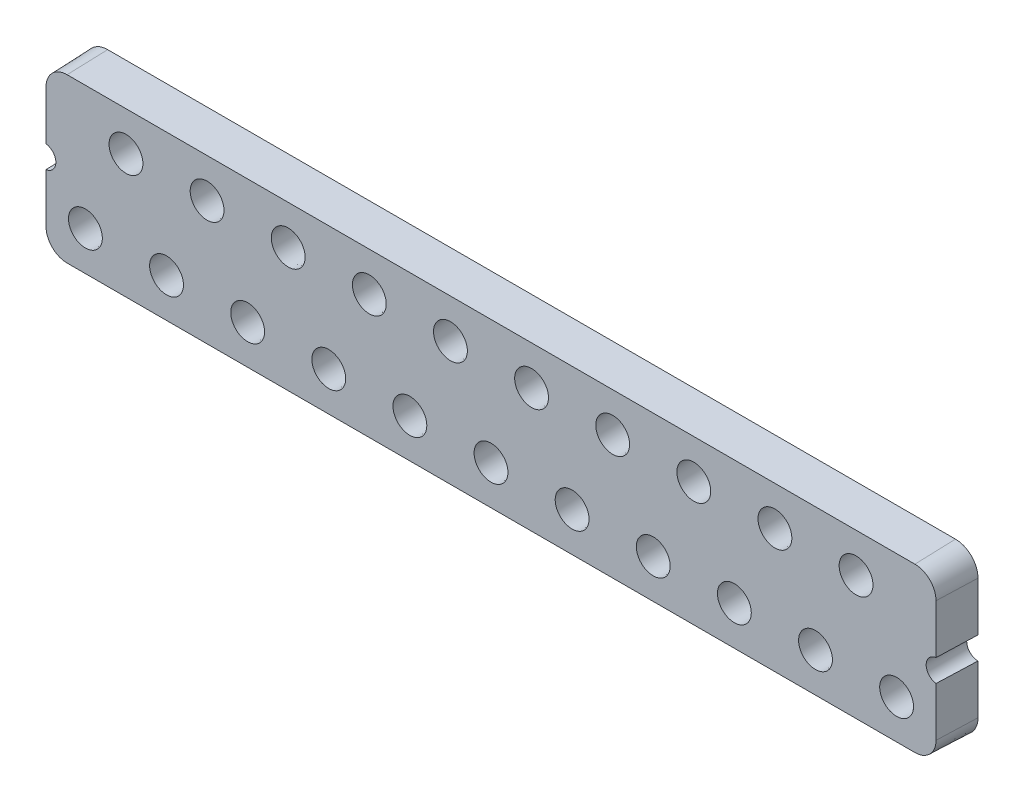
from build123d import *

# Parameters (mm, degrees)
BOSS_EXTRUDE1_DEPTH           = 1.8
BOSS_EXTRUDE1_TAPER           = 2
SKETCH10_R                    = 1.223
CUT_EXTRUDE2_DEPTH            = 0.25
CUT_EXTRUDE2_DRAFT            = 2
CUT_EXTRUDE2_PROFILE_2_DEPTH  = 0.25
CUT_EXTRUDE2_PROFILE_2_DRAFT  = 2
CUT_EXTRUDE2_PROFILE_3_DEPTH  = 0.25
CUT_EXTRUDE2_PROFILE_3_DRAFT  = 2
CUT_EXTRUDE2_PROFILE_4_DEPTH  = 0.25
CUT_EXTRUDE2_PROFILE_4_DRAFT  = 2
CUT_EXTRUDE2_PROFILE_5_DEPTH  = 0.25
CUT_EXTRUDE2_PROFILE_5_DRAFT  = 2
CUT_EXTRUDE2_PROFILE_6_DEPTH  = 0.25
CUT_EXTRUDE2_PROFILE_6_DRAFT  = 2
CUT_EXTRUDE2_PROFILE_7_DEPTH  = 0.25
CUT_EXTRUDE2_PROFILE_7_DRAFT  = 2
CUT_EXTRUDE2_PROFILE_8_DEPTH  = 0.25
CUT_EXTRUDE2_PROFILE_8_DRAFT  = 2
CUT_EXTRUDE2_PROFILE_9_DEPTH  = 0.25
CUT_EXTRUDE2_PROFILE_9_DRAFT  = 2
CUT_EXTRUDE2_PROFILE_10_DEPTH = 0.25
CUT_EXTRUDE2_PROFILE_10_DRAFT = 2
CUT_EXTRUDE2_PROFILE_11_DEPTH = 0.25
CUT_EXTRUDE2_PROFILE_11_DRAFT = 2
CUT_EXTRUDE2_PROFILE_12_DEPTH = 0.25
CUT_EXTRUDE2_PROFILE_12_DRAFT = 2
CUT_EXTRUDE2_PROFILE_13_DEPTH = 0.25
CUT_EXTRUDE2_PROFILE_13_DRAFT = 2
CUT_EXTRUDE2_PROFILE_14_DEPTH = 0.25
CUT_EXTRUDE2_PROFILE_14_DRAFT = 2
CUT_EXTRUDE2_PROFILE_15_DEPTH = 0.25
CUT_EXTRUDE2_PROFILE_15_DRAFT = 2
CUT_EXTRUDE2_PROFILE_16_DEPTH = 0.25
CUT_EXTRUDE2_PROFILE_16_DRAFT = 2
CUT_EXTRUDE2_PROFILE_17_DEPTH = 0.25
CUT_EXTRUDE2_PROFILE_17_DRAFT = 2
CUT_EXTRUDE2_PROFILE_18_DEPTH = 0.25
CUT_EXTRUDE2_PROFILE_18_DRAFT = 2
CUT_EXTRUDE2_PROFILE_19_DEPTH = 0.25
CUT_EXTRUDE2_PROFILE_19_DRAFT = 2
CUT_EXTRUDE2_PROFILE_20_DEPTH = 0.25
CUT_EXTRUDE2_PROFILE_20_DRAFT = 2
CUT_EXTRUDE2_PROFILE_21_DEPTH = 0.25
CUT_EXTRUDE2_PROFILE_21_DRAFT = 2
SKETCH9_R                     = 0.805
CUT_EXTRUDE3_DEPTH            = 21.210945871
CUT_EXTRUDE3_DRAFT            = 2
CUT_EXTRUDE3_PROFILE_2_DEPTH  = 21.210945871
CUT_EXTRUDE3_PROFILE_2_DRAFT  = 2
CUT_EXTRUDE3_PROFILE_3_DEPTH  = 21.210945871
CUT_EXTRUDE3_PROFILE_3_DRAFT  = 2
CUT_EXTRUDE3_PROFILE_4_DEPTH  = 21.210945871
CUT_EXTRUDE3_PROFILE_4_DRAFT  = 2
CUT_EXTRUDE3_PROFILE_5_DEPTH  = 21.210945871
CUT_EXTRUDE3_PROFILE_5_DRAFT  = 2
CUT_EXTRUDE3_PROFILE_6_DEPTH  = 21.210945871
CUT_EXTRUDE3_PROFILE_6_DRAFT  = 2
CUT_EXTRUDE3_PROFILE_7_DEPTH  = 21.210945871
CUT_EXTRUDE3_PROFILE_7_DRAFT  = 2
CUT_EXTRUDE3_PROFILE_8_DEPTH  = 21.210945871
CUT_EXTRUDE3_PROFILE_8_DRAFT  = 2
CUT_EXTRUDE3_PROFILE_9_DEPTH  = 21.210945871
CUT_EXTRUDE3_PROFILE_9_DRAFT  = 2
CUT_EXTRUDE3_PROFILE_10_DEPTH = 21.210945871
CUT_EXTRUDE3_PROFILE_10_DRAFT = 2
CUT_EXTRUDE3_PROFILE_11_DEPTH = 21.210945871
CUT_EXTRUDE3_PROFILE_11_DRAFT = 2
CUT_EXTRUDE3_PROFILE_12_DEPTH = 21.210945871
CUT_EXTRUDE3_PROFILE_12_DRAFT = 2
CUT_EXTRUDE3_PROFILE_13_DEPTH = 21.210945871
CUT_EXTRUDE3_PROFILE_13_DRAFT = 2
CUT_EXTRUDE3_PROFILE_14_DEPTH = 21.210945871
CUT_EXTRUDE3_PROFILE_14_DRAFT = 2
CUT_EXTRUDE3_PROFILE_15_DEPTH = 21.210945871
CUT_EXTRUDE3_PROFILE_15_DRAFT = 2
CUT_EXTRUDE3_PROFILE_16_DEPTH = 21.210945871
CUT_EXTRUDE3_PROFILE_16_DRAFT = 2
CUT_EXTRUDE3_PROFILE_17_DEPTH = 21.210945871
CUT_EXTRUDE3_PROFILE_17_DRAFT = 2
CUT_EXTRUDE3_PROFILE_18_DEPTH = 21.210945871
CUT_EXTRUDE3_PROFILE_18_DRAFT = 2
CUT_EXTRUDE3_PROFILE_19_DEPTH = 21.210945871
CUT_EXTRUDE3_PROFILE_19_DRAFT = 2
CUT_EXTRUDE3_PROFILE_20_DEPTH = 21.210945871
CUT_EXTRUDE3_PROFILE_20_DRAFT = 2
CUT_EXTRUDE3_PROFILE_21_DEPTH = 21.210945871
CUT_EXTRUDE3_PROFILE_21_DRAFT = 2
SKETCH12_R                    = 0.5
CUT_EXTRUDE4_DEPTH            = 21.231654233


with BuildPart() as part:
    # Sketch11 → Boss-Extrude1 (new body)
    with BuildSketch(Plane.XY):
        with BuildLine():
            Line((19.812, 0.5), (19.812, 2.683))
            ThreePointArc((19.812, 2.683), (19.519106781, 3.390106781), (18.812, 3.683))
            Line((18.812, 3.683), (-18.812, 3.683))
            ThreePointArc((-18.812, 3.683), (-19.519106781, 3.390106781), (-19.812, 2.683))
            Line((-19.812, 2.683), (-19.812, 0.5))
            Line((-19.812, 0.5), (-19.812, -0.5))
            Line((-19.812, -0.5), (-19.812, -2.683))
            ThreePointArc((-19.812, -2.683), (-19.519106781, -3.390106781), (-18.812, -3.683))
            Line((-18.812, -3.683), (18.812, -3.683))
            ThreePointArc((18.812, -3.683), (19.519106781, -3.390106781), (19.812, -2.683))
            Line((19.812, -2.683), (19.812, -0.5))
            Line((19.812, -0.5), (19.812, 0.5))
        make_face()
    extrude(amount=BOSS_EXTRUDE1_DEPTH, taper=BOSS_EXTRUDE1_TAPER)


with BuildPart() as cut_extrude2_tool:
    # Sketch10 → Cut-Extrude2 (with draft: the straight prism first)
    with BuildSketch(Plane.XY):
        with Locations((16.2, 1.885)):
            Circle(SKETCH10_R)
    extrude(amount=CUT_EXTRUDE2_DEPTH)
    # Cut-Extrude2: the draft: its side faces are tilted about the plane it starts from
    cut_extrude2_sides = [cut_extrude2_tool.faces().sort_by_distance(p)[0] for p in [
        (14.977, 1.885, 0.125),
    ]]
    draft(cut_extrude2_sides, Plane.XY, CUT_EXTRUDE2_DRAFT)


with BuildPart() as part_1:
    add(part.part)

    # Cut-Extrude2: cut by cut_extrude2_tool
    add(cut_extrude2_tool.part, mode=Mode.SUBTRACT)


with BuildPart() as cut_extrude2_profile_2_tool:
    # Sketch10 → Cut-Extrude2 profile 2 (with draft: the straight prism first)
    with BuildSketch(Plane.XY):
        with Locations((12.6, 1.885)):
            Circle(SKETCH10_R)
    extrude(amount=CUT_EXTRUDE2_PROFILE_2_DEPTH)
    # Cut-Extrude2 profile 2: the draft: its side faces are tilted about the plane it starts from
    cut_extrude2_profile_2_sides = [cut_extrude2_profile_2_tool.faces().sort_by_distance(p)[0] for p in [
        (11.377, 1.885, 0.125),
    ]]
    draft(cut_extrude2_profile_2_sides, Plane.XY, CUT_EXTRUDE2_PROFILE_2_DRAFT)


with BuildPart() as part_2:
    add(part_1.part)

    # Cut-Extrude2 profile 2: cut by cut_extrude2_profile_2_tool
    add(cut_extrude2_profile_2_tool.part, mode=Mode.SUBTRACT)


with BuildPart() as cut_extrude2_profile_3_tool:
    # Sketch10 → Cut-Extrude2 profile 3 (with draft: the straight prism first)
    with BuildSketch(Plane.XY):
        with Locations((9, 1.885)):
            Circle(SKETCH10_R)
    extrude(amount=CUT_EXTRUDE2_PROFILE_3_DEPTH)
    # Cut-Extrude2 profile 3: the draft: its side faces are tilted about the plane it starts from
    cut_extrude2_profile_3_sides = [cut_extrude2_profile_3_tool.faces().sort_by_distance(p)[0] for p in [
        (7.777, 1.885, 0.125),
    ]]
    draft(cut_extrude2_profile_3_sides, Plane.XY, CUT_EXTRUDE2_PROFILE_3_DRAFT)


with BuildPart() as part_3:
    add(part_2.part)

    # Cut-Extrude2 profile 3: cut by cut_extrude2_profile_3_tool
    add(cut_extrude2_profile_3_tool.part, mode=Mode.SUBTRACT)


with BuildPart() as cut_extrude2_profile_4_tool:
    # Sketch10 → Cut-Extrude2 profile 4 (with draft: the straight prism first)
    with BuildSketch(Plane.XY):
        with Locations((5.4, 1.885)):
            Circle(SKETCH10_R)
    extrude(amount=CUT_EXTRUDE2_PROFILE_4_DEPTH)
    # Cut-Extrude2 profile 4: the draft: its side faces are tilted about the plane it starts from
    cut_extrude2_profile_4_sides = [cut_extrude2_profile_4_tool.faces().sort_by_distance(p)[0] for p in [
        (4.177, 1.885, 0.125),
    ]]
    draft(cut_extrude2_profile_4_sides, Plane.XY, CUT_EXTRUDE2_PROFILE_4_DRAFT)


with BuildPart() as part_4:
    add(part_3.part)

    # Cut-Extrude2 profile 4: cut by cut_extrude2_profile_4_tool
    add(cut_extrude2_profile_4_tool.part, mode=Mode.SUBTRACT)


with BuildPart() as cut_extrude2_profile_5_tool:
    # Sketch10 → Cut-Extrude2 profile 5 (with draft: the straight prism first)
    with BuildSketch(Plane.XY):
        with Locations((1.8, 1.885)):
            Circle(SKETCH10_R)
    extrude(amount=CUT_EXTRUDE2_PROFILE_5_DEPTH)
    # Cut-Extrude2 profile 5: the draft: its side faces are tilted about the plane it starts from
    cut_extrude2_profile_5_sides = [cut_extrude2_profile_5_tool.faces().sort_by_distance(p)[0] for p in [
        (0.577, 1.885, 0.125),
    ]]
    draft(cut_extrude2_profile_5_sides, Plane.XY, CUT_EXTRUDE2_PROFILE_5_DRAFT)


with BuildPart() as part_5:
    add(part_4.part)

    # Cut-Extrude2 profile 5: cut by cut_extrude2_profile_5_tool
    add(cut_extrude2_profile_5_tool.part, mode=Mode.SUBTRACT)


with BuildPart() as cut_extrude2_profile_6_tool:
    # Sketch10 → Cut-Extrude2 profile 6 (with draft: the straight prism first)
    with BuildSketch(Plane.XY):
        with Locations((-1.8, 1.885)):
            Circle(SKETCH10_R)
    extrude(amount=CUT_EXTRUDE2_PROFILE_6_DEPTH)
    # Cut-Extrude2 profile 6: the draft: its side faces are tilted about the plane it starts from
    cut_extrude2_profile_6_sides = [cut_extrude2_profile_6_tool.faces().sort_by_distance(p)[0] for p in [
        (-3.023, 1.885, 0.125),
    ]]
    draft(cut_extrude2_profile_6_sides, Plane.XY, CUT_EXTRUDE2_PROFILE_6_DRAFT)


with BuildPart() as part_6:
    add(part_5.part)

    # Cut-Extrude2 profile 6: cut by cut_extrude2_profile_6_tool
    add(cut_extrude2_profile_6_tool.part, mode=Mode.SUBTRACT)


with BuildPart() as cut_extrude2_profile_7_tool:
    # Sketch10 → Cut-Extrude2 profile 7 (with draft: the straight prism first)
    with BuildSketch(Plane.XY):
        with Locations((-5.4, 1.885)):
            Circle(SKETCH10_R)
    extrude(amount=CUT_EXTRUDE2_PROFILE_7_DEPTH)
    # Cut-Extrude2 profile 7: the draft: its side faces are tilted about the plane it starts from
    cut_extrude2_profile_7_sides = [cut_extrude2_profile_7_tool.faces().sort_by_distance(p)[0] for p in [
        (-6.623, 1.885, 0.125),
    ]]
    draft(cut_extrude2_profile_7_sides, Plane.XY, CUT_EXTRUDE2_PROFILE_7_DRAFT)


with BuildPart() as part_7:
    add(part_6.part)

    # Cut-Extrude2 profile 7: cut by cut_extrude2_profile_7_tool
    add(cut_extrude2_profile_7_tool.part, mode=Mode.SUBTRACT)


with BuildPart() as cut_extrude2_profile_8_tool:
    # Sketch10 → Cut-Extrude2 profile 8 (with draft: the straight prism first)
    with BuildSketch(Plane.XY):
        with Locations((-9, 1.885)):
            Circle(SKETCH10_R)
    extrude(amount=CUT_EXTRUDE2_PROFILE_8_DEPTH)
    # Cut-Extrude2 profile 8: the draft: its side faces are tilted about the plane it starts from
    cut_extrude2_profile_8_sides = [cut_extrude2_profile_8_tool.faces().sort_by_distance(p)[0] for p in [
        (-10.223, 1.885, 0.125),
    ]]
    draft(cut_extrude2_profile_8_sides, Plane.XY, CUT_EXTRUDE2_PROFILE_8_DRAFT)


with BuildPart() as part_8:
    add(part_7.part)

    # Cut-Extrude2 profile 8: cut by cut_extrude2_profile_8_tool
    add(cut_extrude2_profile_8_tool.part, mode=Mode.SUBTRACT)


with BuildPart() as cut_extrude2_profile_9_tool:
    # Sketch10 → Cut-Extrude2 profile 9 (with draft: the straight prism first)
    with BuildSketch(Plane.XY):
        with Locations((-12.6, 1.885)):
            Circle(SKETCH10_R)
    extrude(amount=CUT_EXTRUDE2_PROFILE_9_DEPTH)
    # Cut-Extrude2 profile 9: the draft: its side faces are tilted about the plane it starts from
    cut_extrude2_profile_9_sides = [cut_extrude2_profile_9_tool.faces().sort_by_distance(p)[0] for p in [
        (-13.823, 1.885, 0.125),
    ]]
    draft(cut_extrude2_profile_9_sides, Plane.XY, CUT_EXTRUDE2_PROFILE_9_DRAFT)


with BuildPart() as part_9:
    add(part_8.part)

    # Cut-Extrude2 profile 9: cut by cut_extrude2_profile_9_tool
    add(cut_extrude2_profile_9_tool.part, mode=Mode.SUBTRACT)


with BuildPart() as cut_extrude2_profile_10_tool:
    # Sketch10 → Cut-Extrude2 profile 10 (with draft: the straight prism first)
    with BuildSketch(Plane.XY):
        with Locations((-16.2, 1.885)):
            Circle(SKETCH10_R)
    extrude(amount=CUT_EXTRUDE2_PROFILE_10_DEPTH)
    # Cut-Extrude2 profile 10: the draft: its side faces are tilted about the plane it starts from
    cut_extrude2_profile_10_sides = [cut_extrude2_profile_10_tool.faces().sort_by_distance(p)[0] for p in [
        (-17.423, 1.885, 0.125),
    ]]
    draft(cut_extrude2_profile_10_sides, Plane.XY, CUT_EXTRUDE2_PROFILE_10_DRAFT)


with BuildPart() as part_10:
    add(part_9.part)

    # Cut-Extrude2 profile 10: cut by cut_extrude2_profile_10_tool
    add(cut_extrude2_profile_10_tool.part, mode=Mode.SUBTRACT)


with BuildPart() as cut_extrude2_profile_11_tool:
    # Sketch10 → Cut-Extrude2 profile 11 (with draft: the straight prism first)
    with BuildSketch(Plane.XY):
        with Locations((-18, -1.885)):
            Circle(SKETCH10_R)
    extrude(amount=CUT_EXTRUDE2_PROFILE_11_DEPTH)
    # Cut-Extrude2 profile 11: the draft: its side faces are tilted about the plane it starts from
    cut_extrude2_profile_11_sides = [cut_extrude2_profile_11_tool.faces().sort_by_distance(p)[0] for p in [
        (-19.223, -1.885, 0.125),
    ]]
    draft(cut_extrude2_profile_11_sides, Plane.XY, CUT_EXTRUDE2_PROFILE_11_DRAFT)


with BuildPart() as part_11:
    add(part_10.part)

    # Cut-Extrude2 profile 11: cut by cut_extrude2_profile_11_tool
    add(cut_extrude2_profile_11_tool.part, mode=Mode.SUBTRACT)


with BuildPart() as cut_extrude2_profile_12_tool:
    # Sketch10 → Cut-Extrude2 profile 12 (with draft: the straight prism first)
    with BuildSketch(Plane.XY):
        with Locations((-14.4, -1.885)):
            Circle(SKETCH10_R)
    extrude(amount=CUT_EXTRUDE2_PROFILE_12_DEPTH)
    # Cut-Extrude2 profile 12: the draft: its side faces are tilted about the plane it starts from
    cut_extrude2_profile_12_sides = [cut_extrude2_profile_12_tool.faces().sort_by_distance(p)[0] for p in [
        (-15.623, -1.885, 0.125),
    ]]
    draft(cut_extrude2_profile_12_sides, Plane.XY, CUT_EXTRUDE2_PROFILE_12_DRAFT)


with BuildPart() as part_12:
    add(part_11.part)

    # Cut-Extrude2 profile 12: cut by cut_extrude2_profile_12_tool
    add(cut_extrude2_profile_12_tool.part, mode=Mode.SUBTRACT)


with BuildPart() as cut_extrude2_profile_13_tool:
    # Sketch10 → Cut-Extrude2 profile 13 (with draft: the straight prism first)
    with BuildSketch(Plane.XY):
        with Locations((-10.8, -1.885)):
            Circle(SKETCH10_R)
    extrude(amount=CUT_EXTRUDE2_PROFILE_13_DEPTH)
    # Cut-Extrude2 profile 13: the draft: its side faces are tilted about the plane it starts from
    cut_extrude2_profile_13_sides = [cut_extrude2_profile_13_tool.faces().sort_by_distance(p)[0] for p in [
        (-12.023, -1.885, 0.125),
    ]]
    draft(cut_extrude2_profile_13_sides, Plane.XY, CUT_EXTRUDE2_PROFILE_13_DRAFT)


with BuildPart() as part_13:
    add(part_12.part)

    # Cut-Extrude2 profile 13: cut by cut_extrude2_profile_13_tool
    add(cut_extrude2_profile_13_tool.part, mode=Mode.SUBTRACT)


with BuildPart() as cut_extrude2_profile_14_tool:
    # Sketch10 → Cut-Extrude2 profile 14 (with draft: the straight prism first)
    with BuildSketch(Plane.XY):
        with Locations((-7.2, -1.885)):
            Circle(SKETCH10_R)
    extrude(amount=CUT_EXTRUDE2_PROFILE_14_DEPTH)
    # Cut-Extrude2 profile 14: the draft: its side faces are tilted about the plane it starts from
    cut_extrude2_profile_14_sides = [cut_extrude2_profile_14_tool.faces().sort_by_distance(p)[0] for p in [
        (-8.423, -1.885, 0.125),
    ]]
    draft(cut_extrude2_profile_14_sides, Plane.XY, CUT_EXTRUDE2_PROFILE_14_DRAFT)


with BuildPart() as part_14:
    add(part_13.part)

    # Cut-Extrude2 profile 14: cut by cut_extrude2_profile_14_tool
    add(cut_extrude2_profile_14_tool.part, mode=Mode.SUBTRACT)


with BuildPart() as cut_extrude2_profile_15_tool:
    # Sketch10 → Cut-Extrude2 profile 15 (with draft: the straight prism first)
    with BuildSketch(Plane.XY):
        with Locations((-3.6, -1.885)):
            Circle(SKETCH10_R)
    extrude(amount=CUT_EXTRUDE2_PROFILE_15_DEPTH)
    # Cut-Extrude2 profile 15: the draft: its side faces are tilted about the plane it starts from
    cut_extrude2_profile_15_sides = [cut_extrude2_profile_15_tool.faces().sort_by_distance(p)[0] for p in [
        (-4.823, -1.885, 0.125),
    ]]
    draft(cut_extrude2_profile_15_sides, Plane.XY, CUT_EXTRUDE2_PROFILE_15_DRAFT)


with BuildPart() as part_15:
    add(part_14.part)

    # Cut-Extrude2 profile 15: cut by cut_extrude2_profile_15_tool
    add(cut_extrude2_profile_15_tool.part, mode=Mode.SUBTRACT)


with BuildPart() as cut_extrude2_profile_16_tool:
    # Sketch10 → Cut-Extrude2 profile 16 (with draft: the straight prism first)
    with BuildSketch(Plane.XY):
        with Locations((0, -1.885)):
            Circle(SKETCH10_R)
    extrude(amount=CUT_EXTRUDE2_PROFILE_16_DEPTH)
    # Cut-Extrude2 profile 16: the draft: its side faces are tilted about the plane it starts from
    cut_extrude2_profile_16_sides = [cut_extrude2_profile_16_tool.faces().sort_by_distance(p)[0] for p in [
        (-1.223, -1.885, 0.125),
    ]]
    draft(cut_extrude2_profile_16_sides, Plane.XY, CUT_EXTRUDE2_PROFILE_16_DRAFT)


with BuildPart() as part_16:
    add(part_15.part)

    # Cut-Extrude2 profile 16: cut by cut_extrude2_profile_16_tool
    add(cut_extrude2_profile_16_tool.part, mode=Mode.SUBTRACT)


with BuildPart() as cut_extrude2_profile_17_tool:
    # Sketch10 → Cut-Extrude2 profile 17 (with draft: the straight prism first)
    with BuildSketch(Plane.XY):
        with Locations((3.6, -1.885)):
            Circle(SKETCH10_R)
    extrude(amount=CUT_EXTRUDE2_PROFILE_17_DEPTH)
    # Cut-Extrude2 profile 17: the draft: its side faces are tilted about the plane it starts from
    cut_extrude2_profile_17_sides = [cut_extrude2_profile_17_tool.faces().sort_by_distance(p)[0] for p in [
        (2.377, -1.885, 0.125),
    ]]
    draft(cut_extrude2_profile_17_sides, Plane.XY, CUT_EXTRUDE2_PROFILE_17_DRAFT)


with BuildPart() as part_17:
    add(part_16.part)

    # Cut-Extrude2 profile 17: cut by cut_extrude2_profile_17_tool
    add(cut_extrude2_profile_17_tool.part, mode=Mode.SUBTRACT)


with BuildPart() as cut_extrude2_profile_18_tool:
    # Sketch10 → Cut-Extrude2 profile 18 (with draft: the straight prism first)
    with BuildSketch(Plane.XY):
        with Locations((7.2, -1.885)):
            Circle(SKETCH10_R)
    extrude(amount=CUT_EXTRUDE2_PROFILE_18_DEPTH)
    # Cut-Extrude2 profile 18: the draft: its side faces are tilted about the plane it starts from
    cut_extrude2_profile_18_sides = [cut_extrude2_profile_18_tool.faces().sort_by_distance(p)[0] for p in [
        (5.977, -1.885, 0.125),
    ]]
    draft(cut_extrude2_profile_18_sides, Plane.XY, CUT_EXTRUDE2_PROFILE_18_DRAFT)


with BuildPart() as part_18:
    add(part_17.part)

    # Cut-Extrude2 profile 18: cut by cut_extrude2_profile_18_tool
    add(cut_extrude2_profile_18_tool.part, mode=Mode.SUBTRACT)


with BuildPart() as cut_extrude2_profile_19_tool:
    # Sketch10 → Cut-Extrude2 profile 19 (with draft: the straight prism first)
    with BuildSketch(Plane.XY):
        with Locations((10.8, -1.885)):
            Circle(SKETCH10_R)
    extrude(amount=CUT_EXTRUDE2_PROFILE_19_DEPTH)
    # Cut-Extrude2 profile 19: the draft: its side faces are tilted about the plane it starts from
    cut_extrude2_profile_19_sides = [cut_extrude2_profile_19_tool.faces().sort_by_distance(p)[0] for p in [
        (9.577, -1.885, 0.125),
    ]]
    draft(cut_extrude2_profile_19_sides, Plane.XY, CUT_EXTRUDE2_PROFILE_19_DRAFT)


with BuildPart() as part_19:
    add(part_18.part)

    # Cut-Extrude2 profile 19: cut by cut_extrude2_profile_19_tool
    add(cut_extrude2_profile_19_tool.part, mode=Mode.SUBTRACT)


with BuildPart() as cut_extrude2_profile_20_tool:
    # Sketch10 → Cut-Extrude2 profile 20 (with draft: the straight prism first)
    with BuildSketch(Plane.XY):
        with Locations((14.4, -1.885)):
            Circle(SKETCH10_R)
    extrude(amount=CUT_EXTRUDE2_PROFILE_20_DEPTH)
    # Cut-Extrude2 profile 20: the draft: its side faces are tilted about the plane it starts from
    cut_extrude2_profile_20_sides = [cut_extrude2_profile_20_tool.faces().sort_by_distance(p)[0] for p in [
        (13.177, -1.885, 0.125),
    ]]
    draft(cut_extrude2_profile_20_sides, Plane.XY, CUT_EXTRUDE2_PROFILE_20_DRAFT)


with BuildPart() as part_20:
    add(part_19.part)

    # Cut-Extrude2 profile 20: cut by cut_extrude2_profile_20_tool
    add(cut_extrude2_profile_20_tool.part, mode=Mode.SUBTRACT)


with BuildPart() as cut_extrude2_profile_21_tool:
    # Sketch10 → Cut-Extrude2 profile 21 (with draft: the straight prism first)
    with BuildSketch(Plane.XY):
        with Locations((18, -1.885)):
            Circle(SKETCH10_R)
    extrude(amount=CUT_EXTRUDE2_PROFILE_21_DEPTH)
    # Cut-Extrude2 profile 21: the draft: its side faces are tilted about the plane it starts from
    cut_extrude2_profile_21_sides = [cut_extrude2_profile_21_tool.faces().sort_by_distance(p)[0] for p in [
        (16.777, -1.885, 0.125),
    ]]
    draft(cut_extrude2_profile_21_sides, Plane.XY, CUT_EXTRUDE2_PROFILE_21_DRAFT)


with BuildPart() as part_21:
    add(part_20.part)

    # Cut-Extrude2 profile 21: cut by cut_extrude2_profile_21_tool
    add(cut_extrude2_profile_21_tool.part, mode=Mode.SUBTRACT)


with BuildPart() as cut_extrude3_tool:
    # Sketch9 → Cut-Extrude3 (with draft: the straight prism first)
    with BuildSketch(Plane.XY.offset(0.25)):
        with Locations((16.2, 1.885)):
            Circle(SKETCH9_R)
    extrude(amount=CUT_EXTRUDE3_DEPTH)
    # Cut-Extrude3: the draft: its side faces are tilted about the plane it starts from
    cut_extrude3_sides = [cut_extrude3_tool.faces().sort_by_distance(p)[0] for p in [
        (15.395, 1.885, 10.855472935),
    ]]
    draft(cut_extrude3_sides, Plane.XY.offset(0.25), CUT_EXTRUDE3_DRAFT)


with BuildPart() as part_22:
    add(part_21.part)

    # Cut-Extrude3: cut by cut_extrude3_tool
    add(cut_extrude3_tool.part, mode=Mode.SUBTRACT)


with BuildPart() as cut_extrude3_profile_2_tool:
    # Sketch9 → Cut-Extrude3 profile 2 (with draft: the straight prism first)
    with BuildSketch(Plane.XY.offset(0.25)):
        with Locations((12.6, 1.885)):
            Circle(SKETCH9_R)
    extrude(amount=CUT_EXTRUDE3_PROFILE_2_DEPTH)
    # Cut-Extrude3 profile 2: the draft: its side faces are tilted about the plane it starts from
    cut_extrude3_profile_2_sides = [cut_extrude3_profile_2_tool.faces().sort_by_distance(p)[0] for p in [
        (11.795, 1.885, 10.855472935),
    ]]
    draft(cut_extrude3_profile_2_sides, Plane.XY.offset(0.25), CUT_EXTRUDE3_PROFILE_2_DRAFT)


with BuildPart() as part_23:
    add(part_22.part)

    # Cut-Extrude3 profile 2: cut by cut_extrude3_profile_2_tool
    add(cut_extrude3_profile_2_tool.part, mode=Mode.SUBTRACT)


with BuildPart() as cut_extrude3_profile_3_tool:
    # Sketch9 → Cut-Extrude3 profile 3 (with draft: the straight prism first)
    with BuildSketch(Plane.XY.offset(0.25)):
        with Locations((9, 1.885)):
            Circle(SKETCH9_R)
    extrude(amount=CUT_EXTRUDE3_PROFILE_3_DEPTH)
    # Cut-Extrude3 profile 3: the draft: its side faces are tilted about the plane it starts from
    cut_extrude3_profile_3_sides = [cut_extrude3_profile_3_tool.faces().sort_by_distance(p)[0] for p in [
        (8.195, 1.885, 10.855472935),
    ]]
    draft(cut_extrude3_profile_3_sides, Plane.XY.offset(0.25), CUT_EXTRUDE3_PROFILE_3_DRAFT)


with BuildPart() as part_24:
    add(part_23.part)

    # Cut-Extrude3 profile 3: cut by cut_extrude3_profile_3_tool
    add(cut_extrude3_profile_3_tool.part, mode=Mode.SUBTRACT)


with BuildPart() as cut_extrude3_profile_4_tool:
    # Sketch9 → Cut-Extrude3 profile 4 (with draft: the straight prism first)
    with BuildSketch(Plane.XY.offset(0.25)):
        with Locations((5.4, 1.885)):
            Circle(SKETCH9_R)
    extrude(amount=CUT_EXTRUDE3_PROFILE_4_DEPTH)
    # Cut-Extrude3 profile 4: the draft: its side faces are tilted about the plane it starts from
    cut_extrude3_profile_4_sides = [cut_extrude3_profile_4_tool.faces().sort_by_distance(p)[0] for p in [
        (4.595, 1.885, 10.855472935),
    ]]
    draft(cut_extrude3_profile_4_sides, Plane.XY.offset(0.25), CUT_EXTRUDE3_PROFILE_4_DRAFT)


with BuildPart() as part_25:
    add(part_24.part)

    # Cut-Extrude3 profile 4: cut by cut_extrude3_profile_4_tool
    add(cut_extrude3_profile_4_tool.part, mode=Mode.SUBTRACT)


with BuildPart() as cut_extrude3_profile_5_tool:
    # Sketch9 → Cut-Extrude3 profile 5 (with draft: the straight prism first)
    with BuildSketch(Plane.XY.offset(0.25)):
        with Locations((1.8, 1.885)):
            Circle(SKETCH9_R)
    extrude(amount=CUT_EXTRUDE3_PROFILE_5_DEPTH)
    # Cut-Extrude3 profile 5: the draft: its side faces are tilted about the plane it starts from
    cut_extrude3_profile_5_sides = [cut_extrude3_profile_5_tool.faces().sort_by_distance(p)[0] for p in [
        (0.995, 1.885, 10.855472935),
    ]]
    draft(cut_extrude3_profile_5_sides, Plane.XY.offset(0.25), CUT_EXTRUDE3_PROFILE_5_DRAFT)


with BuildPart() as part_26:
    add(part_25.part)

    # Cut-Extrude3 profile 5: cut by cut_extrude3_profile_5_tool
    add(cut_extrude3_profile_5_tool.part, mode=Mode.SUBTRACT)


with BuildPart() as cut_extrude3_profile_6_tool:
    # Sketch9 → Cut-Extrude3 profile 6 (with draft: the straight prism first)
    with BuildSketch(Plane.XY.offset(0.25)):
        with Locations((-1.8, 1.885)):
            Circle(SKETCH9_R)
    extrude(amount=CUT_EXTRUDE3_PROFILE_6_DEPTH)
    # Cut-Extrude3 profile 6: the draft: its side faces are tilted about the plane it starts from
    cut_extrude3_profile_6_sides = [cut_extrude3_profile_6_tool.faces().sort_by_distance(p)[0] for p in [
        (-2.605, 1.885, 10.855472935),
    ]]
    draft(cut_extrude3_profile_6_sides, Plane.XY.offset(0.25), CUT_EXTRUDE3_PROFILE_6_DRAFT)


with BuildPart() as part_27:
    add(part_26.part)

    # Cut-Extrude3 profile 6: cut by cut_extrude3_profile_6_tool
    add(cut_extrude3_profile_6_tool.part, mode=Mode.SUBTRACT)


with BuildPart() as cut_extrude3_profile_7_tool:
    # Sketch9 → Cut-Extrude3 profile 7 (with draft: the straight prism first)
    with BuildSketch(Plane.XY.offset(0.25)):
        with Locations((-5.4, 1.885)):
            Circle(SKETCH9_R)
    extrude(amount=CUT_EXTRUDE3_PROFILE_7_DEPTH)
    # Cut-Extrude3 profile 7: the draft: its side faces are tilted about the plane it starts from
    cut_extrude3_profile_7_sides = [cut_extrude3_profile_7_tool.faces().sort_by_distance(p)[0] for p in [
        (-6.205, 1.885, 10.855472935),
    ]]
    draft(cut_extrude3_profile_7_sides, Plane.XY.offset(0.25), CUT_EXTRUDE3_PROFILE_7_DRAFT)


with BuildPart() as part_28:
    add(part_27.part)

    # Cut-Extrude3 profile 7: cut by cut_extrude3_profile_7_tool
    add(cut_extrude3_profile_7_tool.part, mode=Mode.SUBTRACT)


with BuildPart() as cut_extrude3_profile_8_tool:
    # Sketch9 → Cut-Extrude3 profile 8 (with draft: the straight prism first)
    with BuildSketch(Plane.XY.offset(0.25)):
        with Locations((-9, 1.885)):
            Circle(SKETCH9_R)
    extrude(amount=CUT_EXTRUDE3_PROFILE_8_DEPTH)
    # Cut-Extrude3 profile 8: the draft: its side faces are tilted about the plane it starts from
    cut_extrude3_profile_8_sides = [cut_extrude3_profile_8_tool.faces().sort_by_distance(p)[0] for p in [
        (-9.805, 1.885, 10.855472935),
    ]]
    draft(cut_extrude3_profile_8_sides, Plane.XY.offset(0.25), CUT_EXTRUDE3_PROFILE_8_DRAFT)


with BuildPart() as part_29:
    add(part_28.part)

    # Cut-Extrude3 profile 8: cut by cut_extrude3_profile_8_tool
    add(cut_extrude3_profile_8_tool.part, mode=Mode.SUBTRACT)


with BuildPart() as cut_extrude3_profile_9_tool:
    # Sketch9 → Cut-Extrude3 profile 9 (with draft: the straight prism first)
    with BuildSketch(Plane.XY.offset(0.25)):
        with Locations((-12.6, 1.885)):
            Circle(SKETCH9_R)
    extrude(amount=CUT_EXTRUDE3_PROFILE_9_DEPTH)
    # Cut-Extrude3 profile 9: the draft: its side faces are tilted about the plane it starts from
    cut_extrude3_profile_9_sides = [cut_extrude3_profile_9_tool.faces().sort_by_distance(p)[0] for p in [
        (-13.405, 1.885, 10.855472935),
    ]]
    draft(cut_extrude3_profile_9_sides, Plane.XY.offset(0.25), CUT_EXTRUDE3_PROFILE_9_DRAFT)


with BuildPart() as part_30:
    add(part_29.part)

    # Cut-Extrude3 profile 9: cut by cut_extrude3_profile_9_tool
    add(cut_extrude3_profile_9_tool.part, mode=Mode.SUBTRACT)


with BuildPart() as cut_extrude3_profile_10_tool:
    # Sketch9 → Cut-Extrude3 profile 10 (with draft: the straight prism first)
    with BuildSketch(Plane.XY.offset(0.25)):
        with Locations((-16.2, 1.885)):
            Circle(SKETCH9_R)
    extrude(amount=CUT_EXTRUDE3_PROFILE_10_DEPTH)
    # Cut-Extrude3 profile 10: the draft: its side faces are tilted about the plane it starts from
    cut_extrude3_profile_10_sides = [cut_extrude3_profile_10_tool.faces().sort_by_distance(p)[0] for p in [
        (-17.005, 1.885, 10.855472935),
    ]]
    draft(cut_extrude3_profile_10_sides, Plane.XY.offset(0.25), CUT_EXTRUDE3_PROFILE_10_DRAFT)


with BuildPart() as part_31:
    add(part_30.part)

    # Cut-Extrude3 profile 10: cut by cut_extrude3_profile_10_tool
    add(cut_extrude3_profile_10_tool.part, mode=Mode.SUBTRACT)


with BuildPart() as cut_extrude3_profile_11_tool:
    # Sketch9 → Cut-Extrude3 profile 11 (with draft: the straight prism first)
    with BuildSketch(Plane.XY.offset(0.25)):
        with Locations((-18, -1.885)):
            Circle(SKETCH9_R)
    extrude(amount=CUT_EXTRUDE3_PROFILE_11_DEPTH)
    # Cut-Extrude3 profile 11: the draft: its side faces are tilted about the plane it starts from
    cut_extrude3_profile_11_sides = [cut_extrude3_profile_11_tool.faces().sort_by_distance(p)[0] for p in [
        (-18.805, -1.885, 10.855472935),
    ]]
    draft(cut_extrude3_profile_11_sides, Plane.XY.offset(0.25), CUT_EXTRUDE3_PROFILE_11_DRAFT)


with BuildPart() as part_32:
    add(part_31.part)

    # Cut-Extrude3 profile 11: cut by cut_extrude3_profile_11_tool
    add(cut_extrude3_profile_11_tool.part, mode=Mode.SUBTRACT)


with BuildPart() as cut_extrude3_profile_12_tool:
    # Sketch9 → Cut-Extrude3 profile 12 (with draft: the straight prism first)
    with BuildSketch(Plane.XY.offset(0.25)):
        with Locations((-14.4, -1.885)):
            Circle(SKETCH9_R)
    extrude(amount=CUT_EXTRUDE3_PROFILE_12_DEPTH)
    # Cut-Extrude3 profile 12: the draft: its side faces are tilted about the plane it starts from
    cut_extrude3_profile_12_sides = [cut_extrude3_profile_12_tool.faces().sort_by_distance(p)[0] for p in [
        (-15.205, -1.885, 10.855472935),
    ]]
    draft(cut_extrude3_profile_12_sides, Plane.XY.offset(0.25), CUT_EXTRUDE3_PROFILE_12_DRAFT)


with BuildPart() as part_33:
    add(part_32.part)

    # Cut-Extrude3 profile 12: cut by cut_extrude3_profile_12_tool
    add(cut_extrude3_profile_12_tool.part, mode=Mode.SUBTRACT)


with BuildPart() as cut_extrude3_profile_13_tool:
    # Sketch9 → Cut-Extrude3 profile 13 (with draft: the straight prism first)
    with BuildSketch(Plane.XY.offset(0.25)):
        with Locations((-10.8, -1.885)):
            Circle(SKETCH9_R)
    extrude(amount=CUT_EXTRUDE3_PROFILE_13_DEPTH)
    # Cut-Extrude3 profile 13: the draft: its side faces are tilted about the plane it starts from
    cut_extrude3_profile_13_sides = [cut_extrude3_profile_13_tool.faces().sort_by_distance(p)[0] for p in [
        (-11.605, -1.885, 10.855472935),
    ]]
    draft(cut_extrude3_profile_13_sides, Plane.XY.offset(0.25), CUT_EXTRUDE3_PROFILE_13_DRAFT)


with BuildPart() as part_34:
    add(part_33.part)

    # Cut-Extrude3 profile 13: cut by cut_extrude3_profile_13_tool
    add(cut_extrude3_profile_13_tool.part, mode=Mode.SUBTRACT)


with BuildPart() as cut_extrude3_profile_14_tool:
    # Sketch9 → Cut-Extrude3 profile 14 (with draft: the straight prism first)
    with BuildSketch(Plane.XY.offset(0.25)):
        with Locations((-7.2, -1.885)):
            Circle(SKETCH9_R)
    extrude(amount=CUT_EXTRUDE3_PROFILE_14_DEPTH)
    # Cut-Extrude3 profile 14: the draft: its side faces are tilted about the plane it starts from
    cut_extrude3_profile_14_sides = [cut_extrude3_profile_14_tool.faces().sort_by_distance(p)[0] for p in [
        (-8.005, -1.885, 10.855472935),
    ]]
    draft(cut_extrude3_profile_14_sides, Plane.XY.offset(0.25), CUT_EXTRUDE3_PROFILE_14_DRAFT)


with BuildPart() as part_35:
    add(part_34.part)

    # Cut-Extrude3 profile 14: cut by cut_extrude3_profile_14_tool
    add(cut_extrude3_profile_14_tool.part, mode=Mode.SUBTRACT)


with BuildPart() as cut_extrude3_profile_15_tool:
    # Sketch9 → Cut-Extrude3 profile 15 (with draft: the straight prism first)
    with BuildSketch(Plane.XY.offset(0.25)):
        with Locations((-3.6, -1.885)):
            Circle(SKETCH9_R)
    extrude(amount=CUT_EXTRUDE3_PROFILE_15_DEPTH)
    # Cut-Extrude3 profile 15: the draft: its side faces are tilted about the plane it starts from
    cut_extrude3_profile_15_sides = [cut_extrude3_profile_15_tool.faces().sort_by_distance(p)[0] for p in [
        (-4.405, -1.885, 10.855472935),
    ]]
    draft(cut_extrude3_profile_15_sides, Plane.XY.offset(0.25), CUT_EXTRUDE3_PROFILE_15_DRAFT)


with BuildPart() as part_36:
    add(part_35.part)

    # Cut-Extrude3 profile 15: cut by cut_extrude3_profile_15_tool
    add(cut_extrude3_profile_15_tool.part, mode=Mode.SUBTRACT)


with BuildPart() as cut_extrude3_profile_16_tool:
    # Sketch9 → Cut-Extrude3 profile 16 (with draft: the straight prism first)
    with BuildSketch(Plane.XY.offset(0.25)):
        with Locations((0, -1.885)):
            Circle(SKETCH9_R)
    extrude(amount=CUT_EXTRUDE3_PROFILE_16_DEPTH)
    # Cut-Extrude3 profile 16: the draft: its side faces are tilted about the plane it starts from
    cut_extrude3_profile_16_sides = [cut_extrude3_profile_16_tool.faces().sort_by_distance(p)[0] for p in [
        (-0.805, -1.885, 10.855472935),
    ]]
    draft(cut_extrude3_profile_16_sides, Plane.XY.offset(0.25), CUT_EXTRUDE3_PROFILE_16_DRAFT)


with BuildPart() as part_37:
    add(part_36.part)

    # Cut-Extrude3 profile 16: cut by cut_extrude3_profile_16_tool
    add(cut_extrude3_profile_16_tool.part, mode=Mode.SUBTRACT)


with BuildPart() as cut_extrude3_profile_17_tool:
    # Sketch9 → Cut-Extrude3 profile 17 (with draft: the straight prism first)
    with BuildSketch(Plane.XY.offset(0.25)):
        with Locations((3.6, -1.885)):
            Circle(SKETCH9_R)
    extrude(amount=CUT_EXTRUDE3_PROFILE_17_DEPTH)
    # Cut-Extrude3 profile 17: the draft: its side faces are tilted about the plane it starts from
    cut_extrude3_profile_17_sides = [cut_extrude3_profile_17_tool.faces().sort_by_distance(p)[0] for p in [
        (2.795, -1.885, 10.855472935),
    ]]
    draft(cut_extrude3_profile_17_sides, Plane.XY.offset(0.25), CUT_EXTRUDE3_PROFILE_17_DRAFT)


with BuildPart() as part_38:
    add(part_37.part)

    # Cut-Extrude3 profile 17: cut by cut_extrude3_profile_17_tool
    add(cut_extrude3_profile_17_tool.part, mode=Mode.SUBTRACT)


with BuildPart() as cut_extrude3_profile_18_tool:
    # Sketch9 → Cut-Extrude3 profile 18 (with draft: the straight prism first)
    with BuildSketch(Plane.XY.offset(0.25)):
        with Locations((7.2, -1.885)):
            Circle(SKETCH9_R)
    extrude(amount=CUT_EXTRUDE3_PROFILE_18_DEPTH)
    # Cut-Extrude3 profile 18: the draft: its side faces are tilted about the plane it starts from
    cut_extrude3_profile_18_sides = [cut_extrude3_profile_18_tool.faces().sort_by_distance(p)[0] for p in [
        (6.395, -1.885, 10.855472935),
    ]]
    draft(cut_extrude3_profile_18_sides, Plane.XY.offset(0.25), CUT_EXTRUDE3_PROFILE_18_DRAFT)


with BuildPart() as part_39:
    add(part_38.part)

    # Cut-Extrude3 profile 18: cut by cut_extrude3_profile_18_tool
    add(cut_extrude3_profile_18_tool.part, mode=Mode.SUBTRACT)


with BuildPart() as cut_extrude3_profile_19_tool:
    # Sketch9 → Cut-Extrude3 profile 19 (with draft: the straight prism first)
    with BuildSketch(Plane.XY.offset(0.25)):
        with Locations((10.8, -1.885)):
            Circle(SKETCH9_R)
    extrude(amount=CUT_EXTRUDE3_PROFILE_19_DEPTH)
    # Cut-Extrude3 profile 19: the draft: its side faces are tilted about the plane it starts from
    cut_extrude3_profile_19_sides = [cut_extrude3_profile_19_tool.faces().sort_by_distance(p)[0] for p in [
        (9.995, -1.885, 10.855472935),
    ]]
    draft(cut_extrude3_profile_19_sides, Plane.XY.offset(0.25), CUT_EXTRUDE3_PROFILE_19_DRAFT)


with BuildPart() as part_40:
    add(part_39.part)

    # Cut-Extrude3 profile 19: cut by cut_extrude3_profile_19_tool
    add(cut_extrude3_profile_19_tool.part, mode=Mode.SUBTRACT)


with BuildPart() as cut_extrude3_profile_20_tool:
    # Sketch9 → Cut-Extrude3 profile 20 (with draft: the straight prism first)
    with BuildSketch(Plane.XY.offset(0.25)):
        with Locations((14.4, -1.885)):
            Circle(SKETCH9_R)
    extrude(amount=CUT_EXTRUDE3_PROFILE_20_DEPTH)
    # Cut-Extrude3 profile 20: the draft: its side faces are tilted about the plane it starts from
    cut_extrude3_profile_20_sides = [cut_extrude3_profile_20_tool.faces().sort_by_distance(p)[0] for p in [
        (13.595, -1.885, 10.855472935),
    ]]
    draft(cut_extrude3_profile_20_sides, Plane.XY.offset(0.25), CUT_EXTRUDE3_PROFILE_20_DRAFT)


with BuildPart() as part_41:
    add(part_40.part)

    # Cut-Extrude3 profile 20: cut by cut_extrude3_profile_20_tool
    add(cut_extrude3_profile_20_tool.part, mode=Mode.SUBTRACT)


with BuildPart() as cut_extrude3_profile_21_tool:
    # Sketch9 → Cut-Extrude3 profile 21 (with draft: the straight prism first)
    with BuildSketch(Plane.XY.offset(0.25)):
        with Locations((18, -1.885)):
            Circle(SKETCH9_R)
    extrude(amount=CUT_EXTRUDE3_PROFILE_21_DEPTH)
    # Cut-Extrude3 profile 21: the draft: its side faces are tilted about the plane it starts from
    cut_extrude3_profile_21_sides = [cut_extrude3_profile_21_tool.faces().sort_by_distance(p)[0] for p in [
        (17.195, -1.885, 10.855472935),
    ]]
    draft(cut_extrude3_profile_21_sides, Plane.XY.offset(0.25), CUT_EXTRUDE3_PROFILE_21_DRAFT)


with BuildPart() as part_42:
    add(part_41.part)

    # Cut-Extrude3 profile 21: cut by cut_extrude3_profile_21_tool
    add(cut_extrude3_profile_21_tool.part, mode=Mode.SUBTRACT)

    # Sketch12 → Cut-Extrude4 (cut, through all)
    with BuildSketch(Plane.XY):
        with Locations((19.812, 0)):
            Circle(SKETCH12_R)
        with Locations((-19.812, 0)):
            Circle(SKETCH12_R)
    extrude(amount=CUT_EXTRUDE4_DEPTH, mode=Mode.SUBTRACT)


solid = part_42.part
